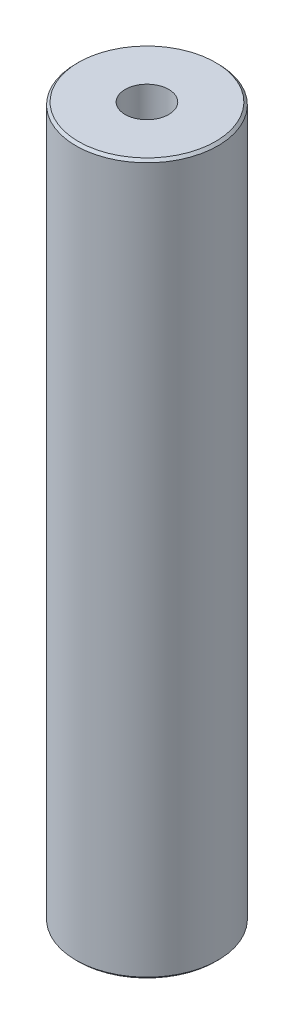
from build123d import *

# Parameters (mm, degrees)
SKETCH1_R           = 60
BOSS_EXTRUDE1_DEPTH = 600
SKETCH2_R           = 18.416918006
CUT_EXTRUDE1_DEPTH  = 606.970296302
CHAMFER1_SIZE       = 2.093704611


with BuildPart() as part:
    # Sketch1 → Boss-Extrude1 (new body)
    with BuildSketch(Plane(origin=(0, 0, 0), x_dir=(1, 0, 0), z_dir=(0, 1, 0))):
        Circle(SKETCH1_R)
    extrude(amount=BOSS_EXTRUDE1_DEPTH)

    # Sketch2 → Cut-Extrude1 (cut, through all)
    with BuildSketch(Plane(origin=(0, 0, 0), x_dir=(1, 0, 0), z_dir=(0, 1, 0))):
        Circle(SKETCH2_R)
    extrude(amount=CUT_EXTRUDE1_DEPTH, mode=Mode.SUBTRACT)

    # Chamfer1
    chamfer1_edges = [part.edges().sort_by_distance(p)[0] for p in [
        (-60, 600, 0),
        (-60, 0, 0),
    ]]
    chamfer(chamfer1_edges, length=CHAMFER1_SIZE)


solid = part.part
